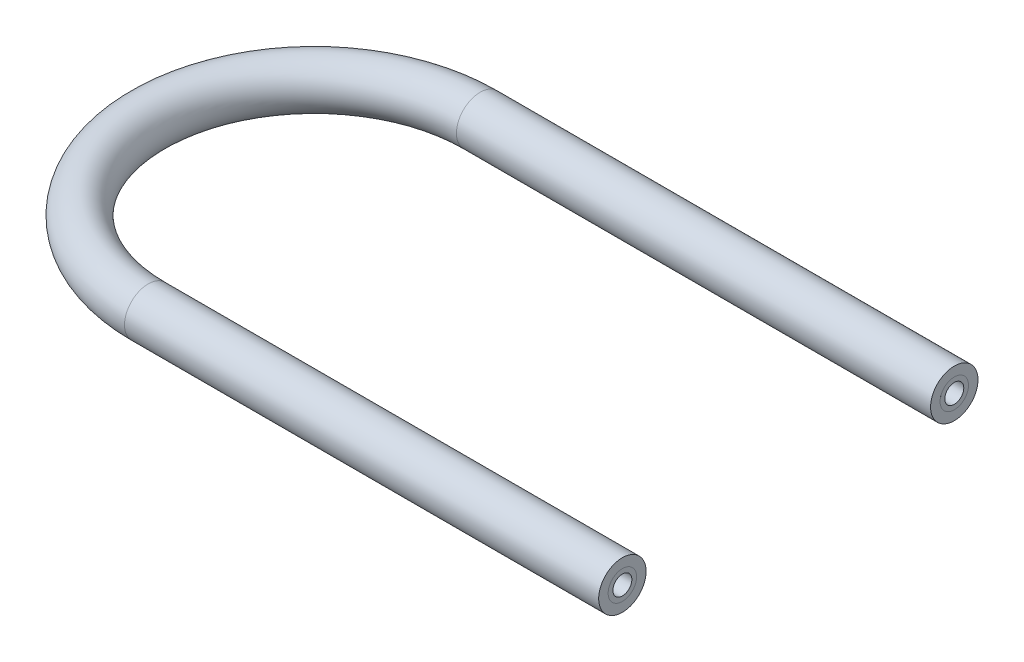
from build123d import *

# Parameters (mm, degrees)
SCHIZZO1_R                     = 5
SCHIZZO1_R_2                   = 3
ESTRUSIONE_ESTRUSIONE1_DEPTH   = 100
ESTRUSIONE_ESTRUSIONE1_2_DEPTH = 100
SWEEP2_OUTLINE_R               = 5
SWEEP2_OUTLINE_R_2             = 3
SWEEP2_ANGLE                   = 180
SCHIZZO6_R                     = 3
SCHIZZO6_R_2                   = 2
ESTRUSIONE_ESTRUSIONE3_DEPTH   = 100
ESTRUSIONE_ESTRUSIONE3_2_DEPTH = 100
SWEEP3_OUTLINE_R               = 3
SWEEP3_OUTLINE_R_2             = 2
SWEEP3_ANGLE                   = 180


# Read off the part's stored shape, not the designer's step: Sweep2, Sweep3
with BuildPart() as part:
    # Schizzo1 → Estrusione-Estrusione1 (new body)
    with BuildSketch(Plane(origin=(0, 0, 0), x_dir=(0, 0, -1), z_dir=(1, 0, 0))):
        with Locations((35, 0)):
            Circle(SCHIZZO1_R)
        with Locations((35, 0)):
            Circle(SCHIZZO1_R_2, mode=Mode.SUBTRACT)
    extrude(amount=-ESTRUSIONE_ESTRUSIONE1_DEPTH)



with BuildPart() as body_2:
    # Schizzo1 → Estrusione-Estrusione1 2 (new body)
    with BuildSketch(Plane(origin=(0, 0, 0), x_dir=(0, 0, -1), z_dir=(1, 0, 0))):
        with Locations((-35, 0)):
            Circle(SCHIZZO1_R)
        with Locations((-35, 0)):
            Circle(SCHIZZO1_R_2, mode=Mode.SUBTRACT)
    extrude(amount=-ESTRUSIONE_ESTRUSIONE1_2_DEPTH)


with BuildPart() as part_1:
    add(part.part)

    add(body_2.part)  # Sweep2 merges body 2
    # Sweep2 outline → Sweep2 (revolve)
    with BuildSketch(Plane(origin=(-100, 0, 0), x_dir=(0, 0, -1), z_dir=(1, 0, 0))):
        with Locations((35, 0)):
            Circle(SWEEP2_OUTLINE_R)
        with Locations((35, 0)):
            Circle(SWEEP2_OUTLINE_R_2, mode=Mode.SUBTRACT)
    revolve(axis=Axis((-100, 0, 0), (0, 1, 0)), revolution_arc=SWEEP2_ANGLE)


with BuildPart() as body_2_2:
    # Schizzo6 → Estrusione-Estrusione3 (new body)
    with BuildSketch(Plane(origin=(0, 0, 0), x_dir=(0, 0, -1), z_dir=(1, 0, 0))):
        with Locations((-35, 0)):
            Circle(SCHIZZO6_R)
        with Locations((-35, 0)):
            Circle(SCHIZZO6_R_2, mode=Mode.SUBTRACT)
    extrude(amount=-ESTRUSIONE_ESTRUSIONE3_DEPTH)



with BuildPart() as body_3:
    # Schizzo6 → Estrusione-Estrusione3 2 (new body)
    with BuildSketch(Plane(origin=(0, 0, 0), x_dir=(0, 0, -1), z_dir=(1, 0, 0))):
        with Locations((35, 0)):
            Circle(SCHIZZO6_R)
        with Locations(Location((35, 0, 0), (0, 0, 180))):
            Circle(SCHIZZO6_R_2, mode=Mode.SUBTRACT)
    extrude(amount=-ESTRUSIONE_ESTRUSIONE3_2_DEPTH)


with BuildPart() as body_2_2_1:
    add(body_2_2.part)

    add(body_3.part)  # Sweep3 merges body 3
    # Sweep3 outline → Sweep3 (revolve)
    with BuildSketch(Plane(origin=(-100, 0, 0), x_dir=(0, 0, -1), z_dir=(1, 0, 0))):
        with Locations((35, 0)):
            Circle(SWEEP3_OUTLINE_R)
        with Locations((35, 0)):
            Circle(SWEEP3_OUTLINE_R_2, mode=Mode.SUBTRACT)
    revolve(axis=Axis((-100, 0, 0), (0, 1, 0)), revolution_arc=SWEEP3_ANGLE)


solid = Compound([part_1.part, body_2_2_1.part])
